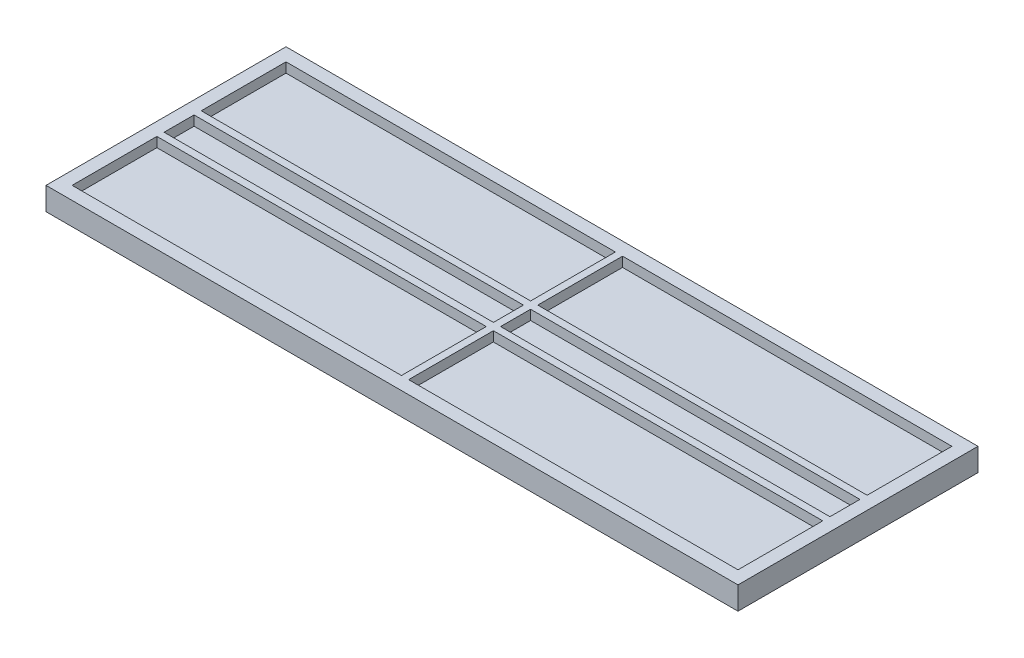
from build123d import *

# Parameters (mm, degrees)
SKETCH1_W           = 168.43375
SKETCH1_H           = 58.42
BOSS_EXTRUDE1_DEPTH = 5.55625
SKETCH2_W           = 80.16875
SKETCH2_H           = 20.6375
SKETCH2_H_2         = 7.29996
CUT_EXTRUDE1_DEPTH  = 2.38125


with BuildPart() as part:
    # Sketch1 → Boss-Extrude1 (new body)
    with BuildSketch(Plane(origin=(0, 0, 0), x_dir=(1, 0, 0), z_dir=(0, 1, 0))):
        Rectangle(SKETCH1_W, SKETCH1_H)
    extrude(amount=BOSS_EXTRUDE1_DEPTH)

    # Sketch2 → Cut-Extrude1 (cut)
    with BuildSketch(Plane(origin=(0, 5.55625, 0), x_dir=(1, 0, 0), z_dir=(0, 1, 0))):
        with Locations((-40.9575, 15.71625)):
            Rectangle(SKETCH2_W, SKETCH2_H)
        with Locations((-40.9575, -15.71625)):
            Rectangle(SKETCH2_W, SKETCH2_H)
        with Locations((40.9575, 15.71625)):
            Rectangle(SKETCH2_W, SKETCH2_H)
        with Locations((40.9575, -15.71625)):
            Rectangle(SKETCH2_W, SKETCH2_H)
        with Locations((-40.9575, 0)):
            Rectangle(SKETCH2_W, SKETCH2_H_2)
        with Locations((40.9575, 0)):
            Rectangle(SKETCH2_W, SKETCH2_H_2)
    extrude(amount=-CUT_EXTRUDE1_DEPTH, mode=Mode.SUBTRACT)


solid = part.part
